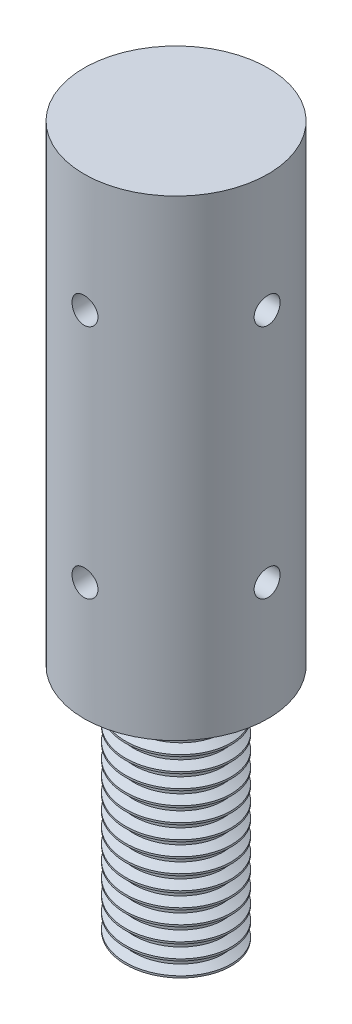
from build123d import *

# Parameters (mm, degrees)
SKETCH1_R           = 4.953
BOSS_EXTRUDE1_DEPTH = 25.4
SKETCH2_R           = 2.413
BOSS_EXTRUDE2_DEPTH = 12.7
THREAD3_PITCH       = 0.79375
THREAD3_FROM        = 1
SKETCH3_R           = 0.6985
CUT_EXTRUDE1_DEPTH  = 3.175
CIRPATTERN1_COUNT   = 4


with BuildPart() as part:
    # Sketch1 → Boss-Extrude1 (new body)
    with BuildSketch(Plane(origin=(0, 0, 0), x_dir=(1, 0, 0), z_dir=(0, 1, 0))):
        with Locations(Location((0, 0, 0), (0, 0, 270))):
            Circle(SKETCH1_R)
    extrude(amount=BOSS_EXTRUDE1_DEPTH)

    # Sketch2 → Boss-Extrude2 (add)
    with BuildSketch(Plane.XZ):
        with Locations(Location((0, 0, 0), (0, 0, 270))):
            Circle(SKETCH2_R)
    extrude(amount=BOSS_EXTRUDE2_DEPTH)

    # Thread3: arcs per turn and ends read off the stored shape
    # Thread3: the profile of Thread Profile6 profile screwed along a left-hand helix through 17.259843 turns, 8 arcs to a turn; built about Z, then put on its axis
    thread3_z = Axis((0, 0, 0), (0, 0, 1))
    thread3_corners = [(2.4127, 0, -0.000173205), (2.842629788, 0, 0.248046874), (2.842629788, 0, 0.347265624), (2.4127, 0, 0.595485703)]
    with BuildLine(mode=Mode.PRIVATE) as thread3_profile:
        Line(thread3_corners[0], thread3_corners[1])
        Line(thread3_corners[1], thread3_corners[2])
        Line(thread3_corners[2], thread3_corners[3])
        Line(thread3_corners[3], thread3_corners[0])
    thread3_cap = Face(thread3_profile.wire())
    thread3_turn_angles = [0, -22.5, -45, -67.5, -90, -112.5, -135, -157.5, -180, -202.5, -225, -247.5, -270, -292.5, -315, -337.5, -360]
    thread3_turn_weights = [1, 0.9238795325112867, 1, 0.9238795325112867, 1, 0.9238795325112867, 1, 0.9238795325112867, 1, 0.9238795325112867, 1, 0.9238795325112867, 1, 0.9238795325112867, 1, 0.9238795325112867, 1]
    thread3_turn_rails = [Edge.make_bspline([Vector(p[0], p[1], 0).rotate(thread3_z, thread3_turn_angles[k]) / thread3_turn_weights[k] + Vector(0, 0, p[2] + -THREAD3_PITCH * thread3_turn_angles[k] / 360) for k in range(17)], [0, 0, 0, 1, 1, 2, 2, 3, 3, 4, 4, 5, 5, 6, 6, 7, 7, 8, 8, 8], 2, thread3_turn_weights) for p in thread3_corners]
    thread3_turn_sides = [Face.make_surface_from_curves(thread3_turn_rails[p[0]], thread3_turn_rails[p[1]]) for p in [(0, 1), (1, 2), (2, 3), (3, 0)]]
    thread3_last_angles = [-6120, -6142.5, -6165, -6187.5, -6210, -6211.771653543, -6213.543307087]
    thread3_last_weights = [1, 0.9238795325112867, 1, 0.9238795325112867, 1, 0.9995219781697027, 1]
    thread3_last_rails = [Edge.make_bspline([Vector(p[0], p[1], 0).rotate(thread3_z, thread3_last_angles[k]) / thread3_last_weights[k] + Vector(0, 0, p[2] + -THREAD3_PITCH * thread3_last_angles[k] / 360) for k in range(7)], [0, 0, 0, 1, 1, 2, 2, 3, 3, 3], 2, thread3_last_weights) for p in thread3_corners]
    thread3_last_sides = [Face.make_surface_from_curves(thread3_last_rails[p[0]], thread3_last_rails[p[1]]) for p in [(0, 1), (1, 2), (2, 3), (3, 0)]]
    thread3 = Plane(origin=(0, -13.7, 0), x_dir=(1, 0, 0), z_dir=(0, 1, 0)) * split(Solid(Shell([*[p.moved(Location((0, 0, THREAD3_PITCH * i))) for i in range(17) for p in thread3_turn_sides], *thread3_last_sides, thread3_cap, thread3_cap.rotate(thread3_z, -6213.543307087).moved(Location((0, 0, -THREAD3_PITCH * -6213.543307087 / 360)))])), bisect_by=Plane.XY.offset(THREAD3_FROM), keep=Keep.TOP, mode=Mode.PRIVATE)
    add(thread3)

    # Sketch3 → Cut-Extrude1 (cut)
    with BuildSketch(Plane.ZY.offset(4.953)):
        with Locations((0, 6.35)):
            Circle(SKETCH3_R)
        with Locations((0, 19.05)):
            Circle(SKETCH3_R)
    cut_extrude1 = extrude(amount=-CUT_EXTRUDE1_DEPTH, mode=Mode.SUBTRACT)

    # CirPattern1: Cut-Extrude1 ×4 about axis
    cirpattern1_axis = Axis((0, 0, 0), (0, 1, 0))
    for i in range(1, CIRPATTERN1_COUNT):
        add(cut_extrude1.rotate(cirpattern1_axis, i * 360 / CIRPATTERN1_COUNT), mode=Mode.SUBTRACT)


solid = part.part
